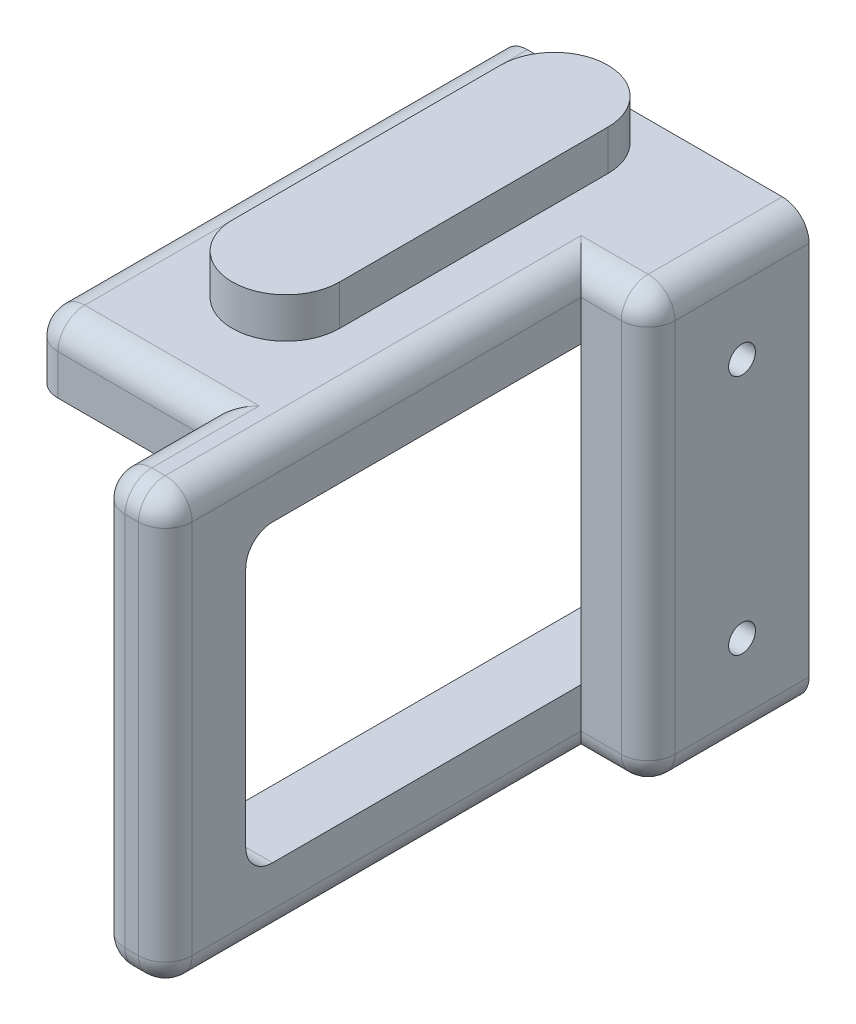
from build123d import *

# Parameters (mm, degrees)
BOSS_EXTRUDE1_DEPTH = 5
SKETCH2_W           = 12
SKETCH2_H           = 32
BOSS_EXTRUDE2_DEPTH = 5
CUT_EXTRUDE1_REACH  = 53.749
SKETCH3_R           = 1
FILLET1_R           = 2
SKETCH5_W           = 35
SKETCH5_H           = 5
BOSS_EXTRUDE3_DEPTH = 13
FILLET2_R           = 2
FILLET3_R           = 2
FILLET4_R           = 2
BOSS_EXTRUDE4_DEPTH = 3


with BuildPart() as part:
    # Sketch1 → Boss-Extrude1 (new body)
    with BuildSketch(Plane(origin=(0, 0, 0), x_dir=(0, 0, -1), z_dir=(1, 0, 0))):
        with BuildLine():
            Line((0, 22), (0, 27))
            Line((0, 27), (-41, 27))
            ThreePointArc((-41, 27), (-42.414213562, 26.414213562), (-43, 25))
            Line((-43, 25), (-43, -3))
            ThreePointArc((-43, -3), (-42.414213562, -4.414213562), (-41, -5))
            Line((-41, -5), (0, -5))
            Line((0, -5), (0, 0))
            Line((0, 0), (-35, 0))
            ThreePointArc((-35, 0), (-36.414213562, 0.585786438), (-37, 2))
            Line((-37, 2), (-37, 20))
            ThreePointArc((-37, 20), (-36.414213562, 21.414213562), (-35, 22))
            Line((-35, 22), (0, 22))
        make_face()
    extrude(amount=-BOSS_EXTRUDE1_DEPTH)

    # Sketch2 → Boss-Extrude2 (add)
    with BuildSketch(Plane(origin=(0, 0, 0), x_dir=(0, 0, -1), z_dir=(1, 0, 0))):
        with Locations((-6, 11)):
            Rectangle(SKETCH2_W, SKETCH2_H)
    extrude(amount=BOSS_EXTRUDE2_DEPTH)

    # Sketch3 → Cut-Extrude1 (cut, up to next)
    with BuildSketch(Plane(origin=(5, 0, 0), x_dir=(0, 0, -1), z_dir=(1, 0, 0)), mode=Mode.PRIVATE) as cut_extrude1_sk1:
        with Locations((-5, 2)):
            Circle(SKETCH3_R)
    cut_extrude1_tool1 = extrude(cut_extrude1_sk1.sketch, amount=-CUT_EXTRUDE1_REACH, mode=Mode.PRIVATE) & part.part
    # Sketch3 → Cut-Extrude1 (cut, up to next)
    with BuildSketch(Plane(origin=(5, 0, 0), x_dir=(0, 0, -1), z_dir=(1, 0, 0)), mode=Mode.PRIVATE) as cut_extrude1_sk2:
        with Locations((-5, 20)):
            Circle(SKETCH3_R)
    cut_extrude1_tool2 = extrude(cut_extrude1_sk2.sketch, amount=-CUT_EXTRUDE1_REACH, mode=Mode.PRIVATE) & part.part
    add(cut_extrude1_tool1.solids().sort_by_distance((5, 2, 5))[0], mode=Mode.SUBTRACT)
    add(cut_extrude1_tool2.solids().sort_by_distance((5, 20, 5))[0], mode=Mode.SUBTRACT)

    # Fillet1
    fillet1_edges = [part.edges().sort_by_distance(p)[0] for p in [
        (5, 27, 6),
        (5, -5, 6),
    ]]
    fillet(fillet1_edges, radius=FILLET1_R)

    # Sketch5 → Boss-Extrude3 (add)
    with BuildSketch(Plane.ZY.offset(5)):
        with Locations((17.5, 24.5)):
            Rectangle(SKETCH5_W, SKETCH5_H)
    extrude(amount=BOSS_EXTRUDE3_DEPTH)

    # Fillet2
    fillet2_edges = [part.edges().sort_by_distance(p)[0] for p in [
        (-18, 24.5, 35),
    ]]
    fillet(fillet2_edges, radius=FILLET2_R)

    # Fillet3
    fillet3_edges = [part.edges().sort_by_distance(p)[0] for p in [
        (-5, 27, 38),
        (-5, 26.414213562, 42.414213562),
        (-5, 11, 43),
        (-5, -5, 20.5),
        (0, 27, 26.5),
        (0, 26.414213562, 42.414213562),
        (0, 11, 43),
        (0, -5, 26.5),
        (1.5, 27, 12),
        (4.414213562, 26.414213562, 12),
        (1.5, -5, 12),
        (4.414213562, -4.414213562, 12),
        (-5, -4.414213562, 42.414213562),
        (0, -4.414213562, 42.414213562),
        (5, 11, 12),
    ]]
    fillet(fillet3_edges, radius=FILLET3_R)

    # Fillet4
    fillet4_edges = [part.edges().sort_by_distance(p)[0] for p in [
        (-18, 27, 16.5),
        (-17.414213562, 27, 34.414213562),
        (-9.5, 27, 35),
    ]]
    fillet(fillet4_edges, radius=FILLET4_R)

    # Encastre → Boss-Extrude4 (add)
    with BuildSketch(Plane(origin=(0, 27, 0), x_dir=(1, 0, 0), z_dir=(0, 1, 0))):
        with BuildLine():
            Line((-5, -5), (-5, -25))
            ThreePointArc((-5, -25), (-9, -29), (-13, -25))
            Line((-13, -25), (-13, -5))
            ThreePointArc((-13, -5), (-9, -1), (-5, -5))
        make_face()
    extrude(amount=BOSS_EXTRUDE4_DEPTH)


solid = part.part
